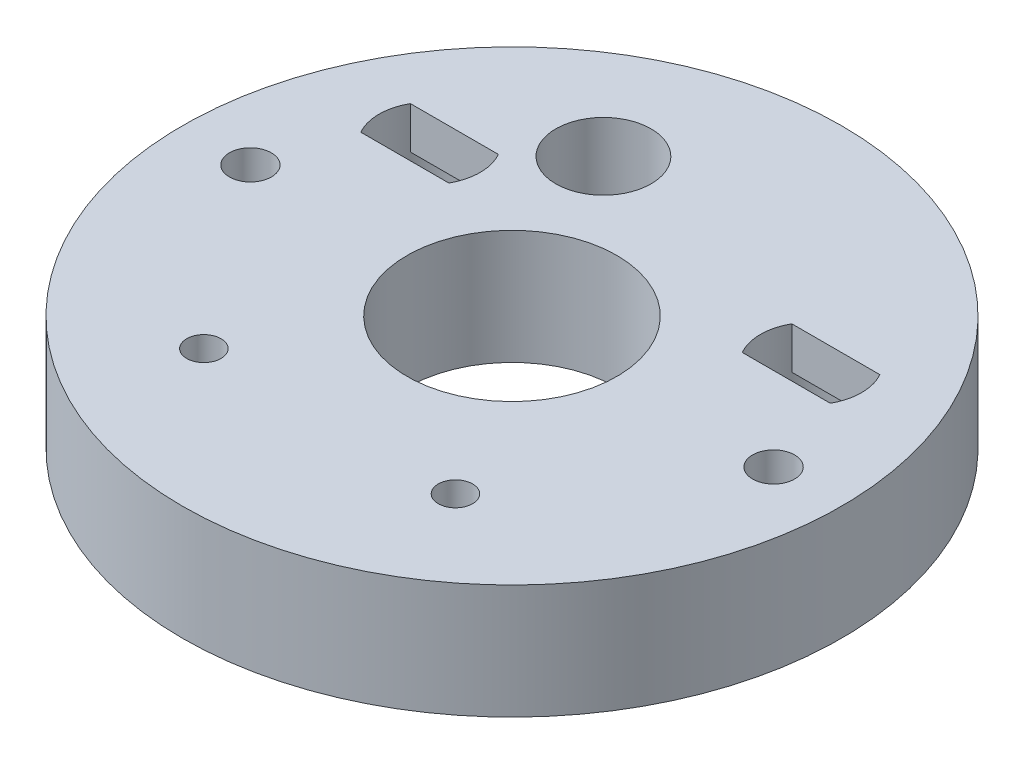
from build123d import *

# Parameters (mm, degrees)
SKETCH_1_R          = 17.28
SKETCH_1_R_2        = 5.5
SKETCH_1_R_3        = 2.65
SKETCH_1_R_4        = 1.9
EXTRUDE_1_DEPTH     = 3.8
SKETCH_2_R          = 2.5
CUT_EXTRUDE_1_DEPTH = 25.731291919
SKETCH_3_R          = 17.28
SKETCH_3_R_2        = 5.5
SKETCH_3_R_3        = 2.5
SKETCH_3_R_4        = 0.9
EXTRUDE_2_DEPTH     = 2.2
SKETCH_4_R          = 1.1
CUT_EXTRUDE_2_DEPTH = 26.163401996
SKETCH_5_R          = 1.6
CUT_EXTRUDE_3_DEPTH = 3


with BuildPart() as part:
    # 草图1 → 凸台-拉伸1 (new body)
    with BuildSketch(Plane(origin=(0, 0, 0), x_dir=(1, 0, 0), z_dir=(0, 1, 0))):
        Circle(SKETCH_1_R)
        Circle(SKETCH_1_R_2, mode=Mode.SUBTRACT)
        with Locations((-10, 5.678908346)):
            Circle(SKETCH_1_R_3, mode=Mode.SUBTRACT)
        with Locations((-6.595, -9.561091654)):
            Circle(SKETCH_1_R_4, mode=Mode.SUBTRACT)
        with Locations((6.595, -9.561091654)):
            Circle(SKETCH_1_R_4, mode=Mode.SUBTRACT)
        with Locations((10, 5.678908346)):
            Circle(SKETCH_1_R_3, mode=Mode.SUBTRACT)
    extrude(amount=EXTRUDE_1_DEPTH)

    # 草图2 → 切除-拉伸1 (cut, through all)
    with BuildSketch(Plane(origin=(0, 3.8, 0), x_dir=(1, 0, 0), z_dir=(0, 1, 0))):
        with Locations((-4.85, 9.644699566)):
            Circle(SKETCH_2_R)
    extrude(amount=-CUT_EXTRUDE_1_DEPTH, mode=Mode.SUBTRACT)

    # 草图3 → 凸台-拉伸2 (add)
    with BuildSketch(Plane(origin=(0, 3.8, 0), x_dir=(1, 0, 0), z_dir=(0, 1, 0))):
        Circle(SKETCH_3_R)
        Circle(SKETCH_3_R_2, mode=Mode.SUBTRACT)
        with Locations((-4.85, 9.644699566)):
            Circle(SKETCH_3_R_3, mode=Mode.SUBTRACT)
        with Locations((-6.595, -9.561091654)):
            Circle(SKETCH_3_R_4, mode=Mode.SUBTRACT)
        with Locations((6.595, -9.561091654)):
            Circle(SKETCH_3_R_4, mode=Mode.SUBTRACT)
        with BuildLine():
            Line((-12.309220648, 4.378908346), (-7.690779352, 4.378908346))
            ThreePointArc((-7.690779352, 4.378908346), (-7.35, 5.678908346), (-7.690779352, 6.978908346))
            Line((-7.690779352, 6.978908346), (-12.309220648, 6.978908346))
            ThreePointArc((-12.309220648, 6.978908346), (-12.65, 5.678908346), (-12.309220648, 4.378908346))
        make_face(mode=Mode.SUBTRACT)
        with BuildLine():
            Line((12.309220648, 4.378908346), (7.690779352, 4.378908346))
            ThreePointArc((7.690779352, 4.378908346), (7.35, 5.678908346), (7.690779352, 6.978908346))
            Line((7.690779352, 6.978908346), (12.309220648, 6.978908346))
            ThreePointArc((12.309220648, 6.978908346), (12.65, 5.678908346), (12.309220648, 4.378908346))
        make_face(mode=Mode.SUBTRACT)
    extrude(amount=EXTRUDE_2_DEPTH)

    # 草图4 → 切除-拉伸2 (cut, through all)
    with BuildSketch(Plane(origin=(0, 6, 0), x_dir=(1, 0, 0), z_dir=(0, 1, 0))):
        with Locations((-13.717, 0)):
            Circle(SKETCH_4_R)
        with Locations((13.717, 0)):
            Circle(SKETCH_4_R)
    extrude(amount=-CUT_EXTRUDE_2_DEPTH, mode=Mode.SUBTRACT)

    # 草图5 → 切除-拉伸3 (cut)
    with BuildSketch(Plane.XZ):
        with Locations((13.717, 0)):
            Circle(SKETCH_5_R)
        with Locations((-13.717, 0)):
            Circle(SKETCH_5_R)
    extrude(amount=-CUT_EXTRUDE_3_DEPTH, mode=Mode.SUBTRACT)


solid = part.part
